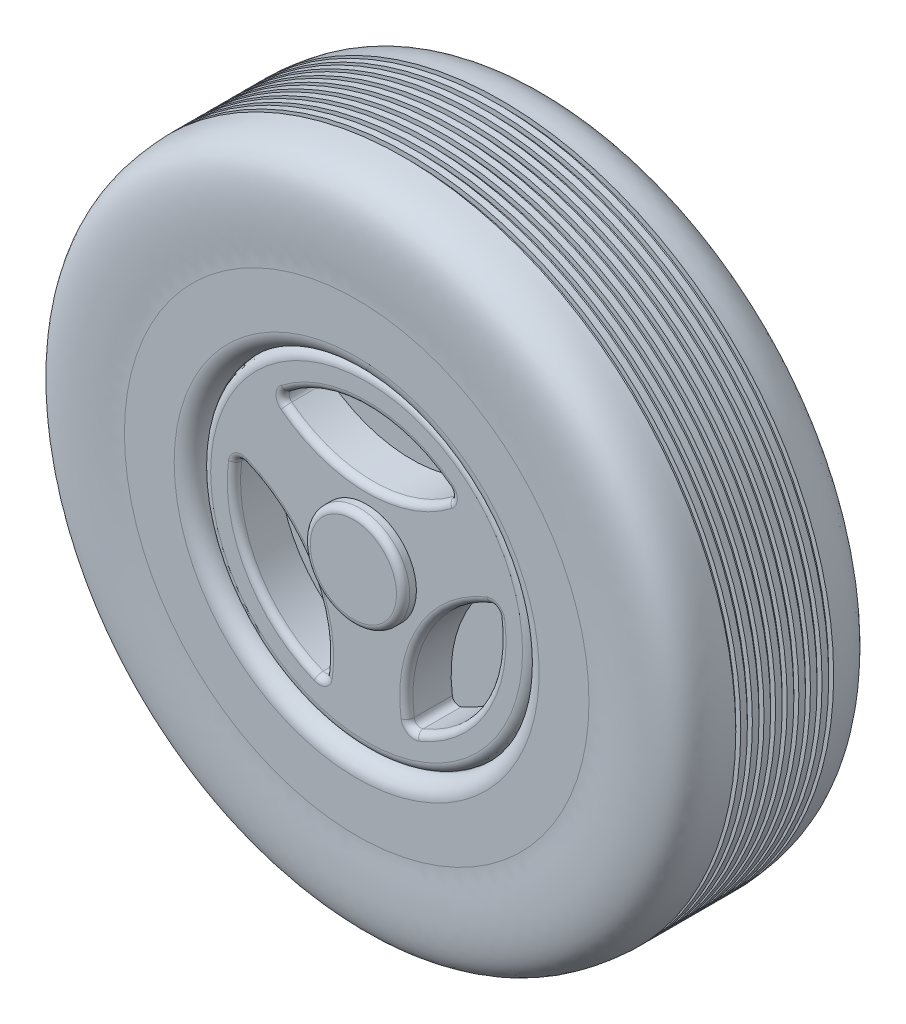
from build123d import *

# Parameters (mm, degrees)
BOSS_EXTRUDE1_DEPTH      = 52
SKETCH4_R                = 15
BOSS_EXTRUDE2_DEPTH      = 4
FILLET4_R                = 2
FILLET4_OF_MIRROR3_R     = 2
FILLET1_R                = 2
FILLET2_R                = 3
FILLET3_R                = 2
BOSS_EXTRUDE4_DEPTH      = 12.5
BOSS_EXTRUDE4_DEPTH_BACK = 12.5
FILLET6_R                = 5
FILLET6_OF_MIRROR4_R     = 5


with BuildPart() as part:
    # Sketch1 → Revolve1 (revolve)
    with BuildSketch(Plane.ZY, mode=Mode.PRIVATE) as revolve1_sk:
        Polygon((-21, -50), (-26, -50), (-26, -40), (26, -40), (26, -50), (21, -50), (21, -45), (-21, -45), align=None)
    revolve(revolve1_sk.sketch.rotate(Axis((0, 0, -101.791486329), (0, 0, 1)), 270), axis=Axis((0, 0, -101.791486329), (0, 0, 1)))

    # Sketch3 → Boss-Extrude1 (add)
    with BuildSketch(Plane.XY.offset(26)):
        with BuildLine():
            ThreePointArc((-26.457513111, 30), (0, 20), (26.457513111, 30))
            ThreePointArc((26.457513111, 30), (34.641016151, 20), (39.209518669, 7.912878475))
            ThreePointArc((39.209518669, 7.912878475), (17.320508076, -10), (12.752005558, -37.912878475))
            ThreePointArc((12.752005558, -37.912878475), (0, -40), (-12.752005558, -37.912878475))
            ThreePointArc((-12.752005558, -37.912878475), (-17.320508076, -10), (-39.209518669, 7.912878475))
            ThreePointArc((-39.209518669, 7.912878475), (-34.641016151, 20), (-26.457513111, 30))
        make_face()
    extrude(amount=-BOSS_EXTRUDE1_DEPTH)


with BuildPart() as body_2:
    # Sketch4 → Boss-Extrude2 (new body)
    with BuildSketch(Plane.XY.offset(26)):
        Circle(SKETCH4_R)
    boss_extrude2 = extrude(amount=BOSS_EXTRUDE2_DEPTH)

    # Fillet4
    fillet4_edges = [body_2.edges().sort_by_distance(p)[0] for p in [
        (-15, 0, 30),
    ]]
    fillet(fillet4_edges, radius=FILLET4_R)


with BuildPart() as part_1:
    add(part.part)

    # Mirror3: Boss-Extrude2 across plane
    add(boss_extrude2.mirror(Plane.XY))

    # Fillet4 of Mirror3
    fillet4_of_mirror3_edges = [part_1.edges().sort_by_distance(p)[0] for p in [
        (-15, 0, -30),
    ]]
    fillet(fillet4_of_mirror3_edges, radius=FILLET4_OF_MIRROR3_R)

    # Fillet1
    fillet1_edges = [part_1.edges().sort_by_distance(p)[0] for p in [
        (45, 0, -21),
        (45, 0, 21),
        (50, 0, 21),
        (50, 0, -21),
    ]]
    fillet(fillet1_edges, radius=FILLET1_R)

    # Fillet2
    fillet2_edges = [part_1.edges().sort_by_distance(p)[0] for p in [
        (50, 0, 26),
        (50, 0, -26),
    ]]
    fillet(fillet2_edges, radius=FILLET2_R - 0.0001)  # a hair under: the kernel refuses the full size

    # Fillet3
    fillet3_edges = [part_1.edges().sort_by_distance(p)[0] for p in [
        (0, 40, 26),
        (34.641016151, -20, 26),
        (-34.641016151, -20, 26),
        (0, 40, -26),
        (34.641016151, -20, -26),
        (-34.641016151, -20, -26),
        (-17.320508076, -10, 26),
        (17.320508076, -10, 26),
        (0, 20, 26),
        (-17.320508076, -10, -26),
        (-12.752005558, -37.912878475, 0),
        (12.752005558, -37.912878475, 0),
        (17.320508076, -10, -26),
        (39.209518669, 7.912878475, 0),
        (26.457513111, 30, 0),
        (0, 20, -26),
        (-26.457513111, 30, 0),
        (-39.209518669, 7.912878475, 0),
    ]]
    fillet(fillet3_edges, radius=FILLET3_R)

    # Sketch8 → Boss-Extrude4 (add, two sides: drawn at the far end of the back side and taken through both)
    with BuildSketch(Plane.XY.offset(-BOSS_EXTRUDE4_DEPTH_BACK)):
        with BuildLine():
            ThreePointArc((-36.889041781, 7.051589344), (-38.642665903, 6.931060684), (-39.623858845, 5.472641975))
            ThreePointArc((-39.623858845, 5.472641975), (-34.641016151, -20), (-15.072482446, -37.051589344))
            ThreePointArc((-15.072482446, -37.051589344), (-13.318858324, -36.931060684), (-12.337665382, -35.472641975))
            ThreePointArc((-12.337665382, -35.472641975), (-17.320508076, -10), (-36.889041781, 7.051589344))
        make_face()
        with BuildLine():
            ThreePointArc((12.337665382, -35.472641975), (13.318858324, -36.931060684), (15.072482446, -37.051589344))
            ThreePointArc((15.072482446, -37.051589344), (34.641016151, -20), (39.623858845, 5.472641975))
            ThreePointArc((39.623858845, 5.472641975), (38.642665903, 6.931060684), (36.889041781, 7.051589344))
            ThreePointArc((36.889041781, 7.051589344), (17.320508076, -10), (12.337665382, -35.472641975))
        make_face()
        with BuildLine():
            ThreePointArc((-24.551376399, 31.578947368), (-25.323807579, 30), (-24.551376399, 28.421052632))
            ThreePointArc((-24.551376399, 28.421052632), (0, 20), (24.551376399, 28.421052632))
            ThreePointArc((24.551376399, 28.421052632), (25.323807579, 30), (24.551376399, 31.578947368))
            ThreePointArc((24.551376399, 31.578947368), (0, 40), (-24.551376399, 31.578947368))
        make_face()
    extrude(amount=BOSS_EXTRUDE4_DEPTH + BOSS_EXTRUDE4_DEPTH_BACK)


with BuildPart() as body_3:
    # Sketch6 → Revolve2 (revolve)
    with BuildSketch(Plane(origin=(0, 0, 0), x_dir=(0, 0, -1), z_dir=(1, 0, 0)), mode=Mode.PRIVATE) as revolve2_sk:
        with BuildLine():
            Line((-29, 50), (-21, 50))
            Line((-21, 50), (-21, 47))
            Line((-21, 47), (0, 47))
            Line((0, 47), (0, 98.5))
            Line((0, 98.5), (-0.75, 98.5))
            Line((-0.75, 98.5), (-0.75, 100))
            Line((-0.75, 100), (-2.75, 100))
            Line((-2.75, 100), (-2.75, 98.5))
            Line((-2.75, 98.5), (-4.25, 98.5))
            Line((-4.25, 98.5), (-4.25, 100))
            Line((-4.25, 100), (-6.25, 100))
            Line((-6.25, 100), (-6.25, 98.5))
            Line((-6.25, 98.5), (-7.75, 98.5))
            Line((-7.75, 98.5), (-7.75, 100))
            Line((-7.75, 100), (-9.75, 100))
            Line((-9.75, 100), (-9.75, 98.5))
            Line((-9.75, 98.5), (-11.25, 98.5))
            Line((-11.25, 98.5), (-11.25, 100))
            Line((-11.25, 100), (-13.25, 100))
            Line((-13.25, 100), (-13.25, 98.5))
            Line((-13.25, 98.5), (-14.75, 98.5))
            Line((-14.75, 98.5), (-14.75, 100))
            add(Edge.make_bspline(
                [(-29, 70), (-29, 74.641200086), (-33.089156979, 99.662811598), (-17.826776001, 99.6741887), (-14.75, 100)],
                knots=[0, 0, 0, 0, 0.508798342, 0.895542017, 0.895542017, 0.895542017, 0.895542017], degree=3))
            Line((-29, 70), (-29, 50))
        make_face()
    revolve2 = revolve(revolve2_sk.sketch.rotate(Axis((0, 0, 102.552642411), (0, 0, -1)), 90), axis=Axis((0, 0, 102.552642411), (0, 0, -1)))

    # Fillet6
    fillet6_edges = [body_3.edges().sort_by_distance(p)[0] for p in [
        (-50, 0, 29),
    ]]
    fillet(fillet6_edges, radius=FILLET6_R)

    # Mirror4: Revolve2 across Front Plane
    add(revolve2.mirror(Plane.XY))

    # Fillet6 of Mirror4
    fillet6_of_mirror4_edges = [body_3.edges().sort_by_distance(p)[0] for p in [
        (-50, 0, -29),
    ]]
    fillet(fillet6_of_mirror4_edges, radius=FILLET6_OF_MIRROR4_R)


solid = Compound([body_2.part, part_1.part, body_3.part])
